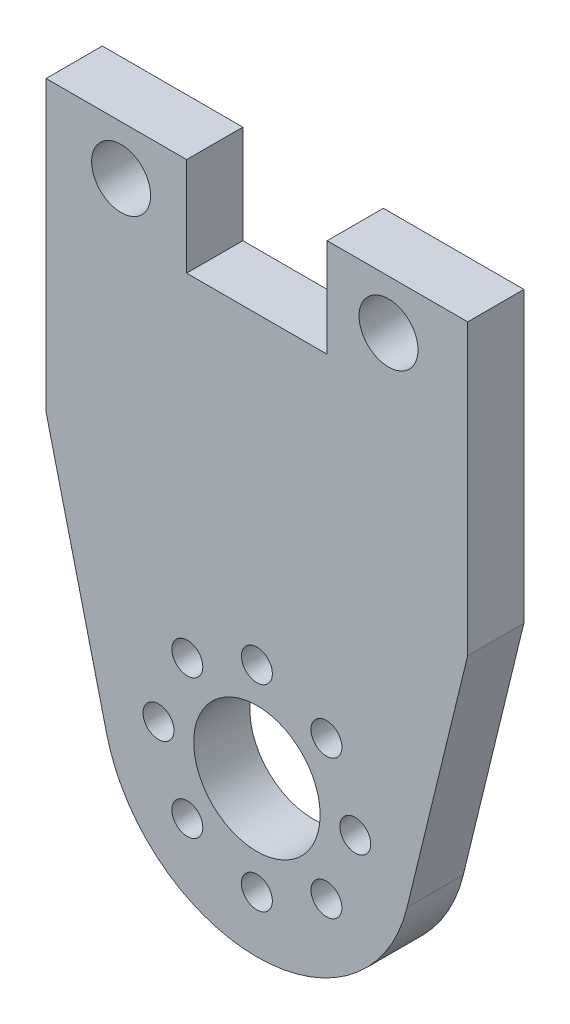
from build123d import *

# Parameters (mm, degrees)
ESQUISSE1_R        = 1.1
ESQUISSE1_R_2      = 4.5
BOSS_EXTRU_1_DEPTH = 4
SKETCH1_R          = 2.1
CUT_EXTRUDE1_DEPTH = 43.574273021


with BuildPart() as part:
    # Esquisse1 → Boss.-Extru.1 (new body)
    with BuildSketch(Plane.XY):
        with BuildLine():
            Line((-15, 7), (-15, 3))
            Line((-15, 3), (-15, -13.574063778))
            Line((-15, -13.574063778), (-10.686419419, -31.250781398))
            ThreePointArc((-10.686419419, -31.250781398), (0, -39.643016072), (10.686419419, -31.250781398))
            Line((10.686419419, -31.250781398), (15, -13.574063778))
            Line((15, -13.574063778), (15, 3))
            Line((15, 3), (15, 7))
            Line((15, 7), (5, 7))
            Line((5, 7), (5, 0))
            Line((5, 0), (-5, 0))
            Line((-5, 0), (-5, 7))
            Line((-5, 7), (-15, 7))
        make_face()
        with Locations((-4.949747468, -33.59276354)):
            Circle(ESQUISSE1_R, mode=Mode.SUBTRACT)
        with Locations((-7, -28.643016072)):
            Circle(ESQUISSE1_R, mode=Mode.SUBTRACT)
        with Locations((-4.949747468, -23.693268604)):
            Circle(ESQUISSE1_R, mode=Mode.SUBTRACT)
        with Locations((0, -35.643016072)):
            Circle(ESQUISSE1_R, mode=Mode.SUBTRACT)
        with Locations((0, -28.643016072)):
            Circle(ESQUISSE1_R_2, mode=Mode.SUBTRACT)
        with Locations((4.949747468, -33.59276354)):
            Circle(ESQUISSE1_R, mode=Mode.SUBTRACT)
        with Locations((7, -28.643016072)):
            Circle(ESQUISSE1_R, mode=Mode.SUBTRACT)
        with Locations((4.949747468, -23.693268604)):
            Circle(ESQUISSE1_R, mode=Mode.SUBTRACT)
        with Locations((0, -21.643016072)):
            Circle(ESQUISSE1_R, mode=Mode.SUBTRACT)
    extrude(amount=BOSS_EXTRU_1_DEPTH)

    # Sketch1 → Cut-Extrude1 (cut, through all)
    with BuildSketch(Plane(origin=(0, 0, 0), x_dir=(-1, 0, 0), z_dir=(0, 0, -1))):
        with Locations((-9.368015407, 3.5)):
            Circle(SKETCH1_R)
        with Locations((9.663609861, 3.5)):
            Circle(SKETCH1_R)
    extrude(amount=-CUT_EXTRUDE1_DEPTH, mode=Mode.SUBTRACT)


solid = part.part
